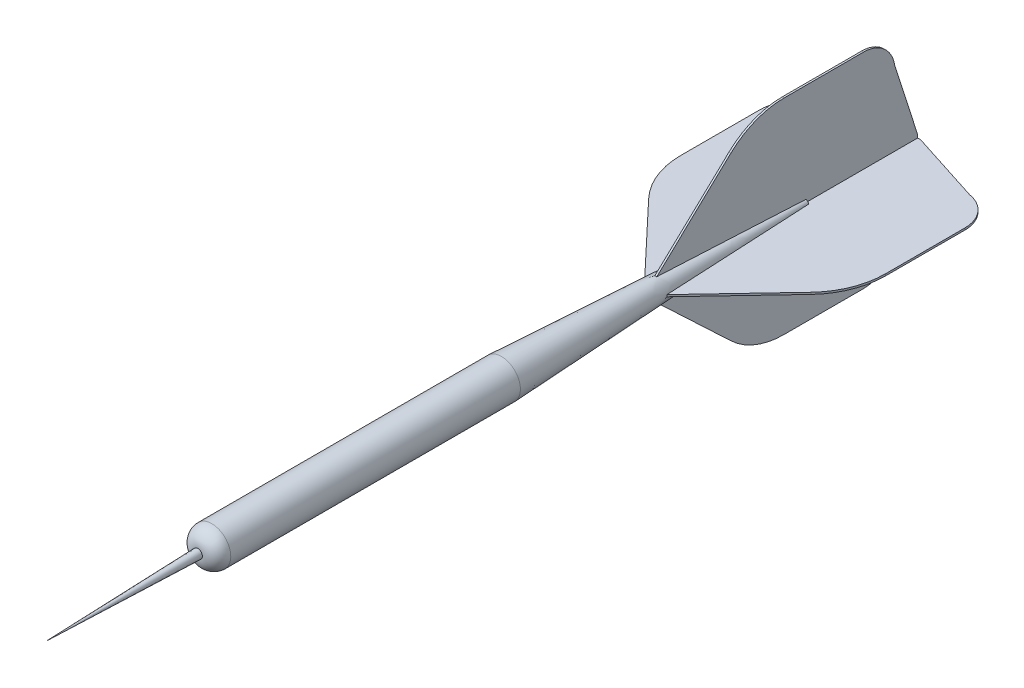
from build123d import *

# Parameters (mm, degrees)
FLIGHT_DEPTH  = 0.125
FLIGHTS_COUNT = 4


with BuildPart() as part:
    # Sketch1 → Dart (revolve)
    with BuildSketch(Plane(origin=(0, 0, 0), x_dir=(0, 0, -1), z_dir=(1, 0, 0))):
        with BuildLine():
            Line((0, 0), (-20, 0))
            Line((-20, 0), (0, 0.6))
            ThreePointArc((0, 0.6), (0.520053411, 1.939998576), (1.843854808, 2.5))
            Line((1.843854808, 2.5), (40, 2.5))
            Line((40, 2.5), (80, 0.5))
            Line((80, 0.5), (80, 0))
            Line((80, 0), (0, 0))
        make_face()
    revolve(axis=Axis((0, 0, -80), (0, 0, 1)))

    # Sketch3 → Flight (add, symmetric)
    with BuildSketch(Plane(origin=(0, 0, 0), x_dir=(0, 0, -1), z_dir=(1, 0, 0))):
        with BuildLine():
            Line((58.773570896, 0), (70.10500512, 10.70601533))
            ThreePointArc((70.10500512, 10.70601533), (73.344015712, 12.771940868), (77.117193802, 13.494689119))
            Line((77.117193802, 13.494689119), (87.581242661, 13.494689119))
            ThreePointArc((87.581242661, 13.494689119), (90.271891194, 12.502516998), (91.674265962, 10.001049418))
            Line((91.674265962, 10.001049418), (94.719101572, 0.5))
            Line((94.719101572, 0.5), (94.719101572, 0))
            Line((94.719101572, 0), (58.773570896, 0))
        make_face()
    flight = extrude(amount=FLIGHT_DEPTH, both=True)

    # Flights: Flight ×4 about axis
    flights_axis = Axis((0, 0, -80), (0, 0, -1))
    for i in range(1, FLIGHTS_COUNT):
        add(flight.rotate(flights_axis, i * 360 / FLIGHTS_COUNT))


solid = part.part
